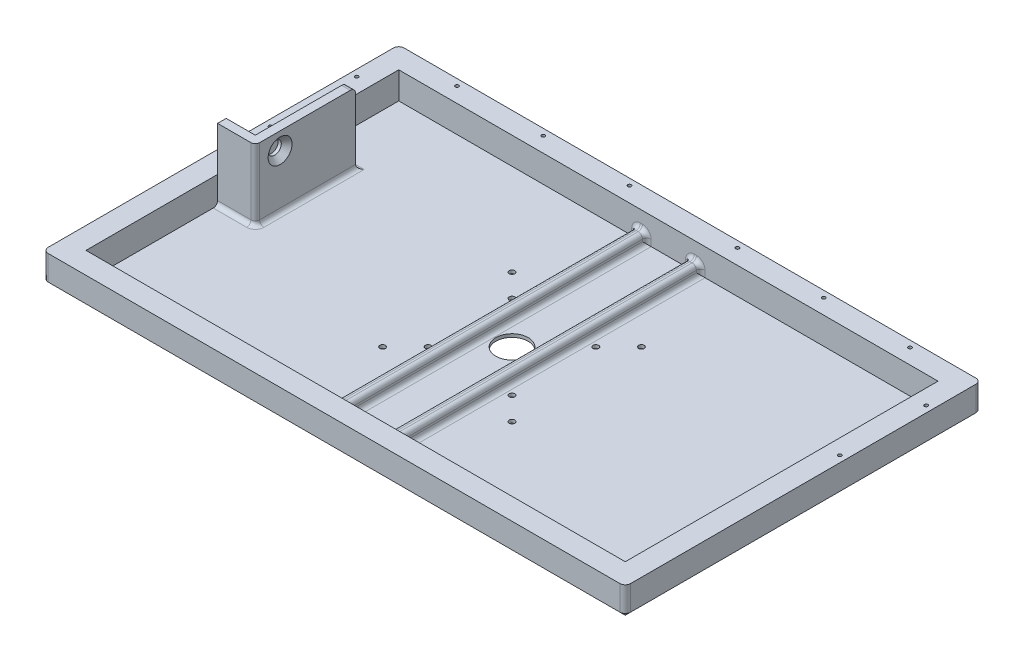
from build123d import *

# Parameters (mm, degrees)
SKETCH1_W           = 540
SKETCH1_H           = 330
BOSS_EXTRUDE1_DEPTH = 3
SKETCH2_W           = 540
SKETCH2_H           = 330
SKETCH2_W_2         = 500
SKETCH2_H_2         = 290
BOSS_EXTRUDE2_DEPTH = 25
FILLET1_R           = 5
SKETCH4_R           = 1.6
CUT_EXTRUDE1_DEPTH  = 28
SKETCH5_R           = 15
CUT_EXTRUDE2_DEPTH  = 3
SKETCH6_W           = 10
SKETCH6_H           = 290
BOSS_EXTRUDE3_DEPTH = 10
FILLET3_R           = 4
CHAMFER1_SIZE       = 5
SKETCH7_R           = 2.6
CUT_EXTRUDE3_DEPTH  = 3
SKETCH9_R           = 2.6
CUT_EXTRUDE4_DEPTH  = 47
SKETCH11_W          = 8
SKETCH11_H          = 140
BOSS_EXTRUDE4_DEPTH = 66
SKETCH12_R          = 6.1
CUT_EXTRUDE5_DEPTH  = 8
SKETCH13_W          = 8
SKETCH13_H          = 69
SKETCH13_W_2        = 20
SKETCH13_H_2        = 40.75
BOSS_EXTRUDE5_DEPTH = 27
SKETCH15_W          = 8
SKETCH15_H          = 47
CUT_EXTRUDE6_DEPTH  = 66
FILLET4_R           = 4
FILLET5_R           = 10
FILLET6_R           = 5
FILLET7_R           = 5
CHAMFER2_SIZE       = 5


with BuildPart() as part:
    # Sketch1 → Boss-Extrude1 (new body)
    with BuildSketch(Plane(origin=(0, 0, 0), x_dir=(1, 0, 0), z_dir=(0, 1, 0))):
        Rectangle(SKETCH1_W, SKETCH1_H)
    extrude(amount=BOSS_EXTRUDE1_DEPTH)

    # Sketch2 → Boss-Extrude2 (add)
    with BuildSketch(Plane(origin=(0, 3, 0), x_dir=(1, 0, 0), z_dir=(0, 1, 0))):
        Rectangle(SKETCH2_W, SKETCH2_H)
        Rectangle(SKETCH2_W_2, SKETCH2_H_2, mode=Mode.SUBTRACT)
    extrude(amount=BOSS_EXTRUDE2_DEPTH)

    # Fillet1
    fillet1_edges = [part.edges().sort_by_distance(p)[0] for p in [
        (270, 14, 165),
        (-270, 14, 165),
        (-270, 14, -165),
        (270, 14, -165),
    ]]
    fillet(fillet1_edges, radius=FILLET1_R)

    # Sketch4 → Cut-Extrude1 (cut)
    with BuildSketch(Plane(origin=(0, 28, 0), x_dir=(1, 0, 0), z_dir=(0, 1, 0))):
        with Locations(Location((-264, 120, 0), (0, 0, 270))):
            Circle(SKETCH4_R)
        with Locations(Location((-264, 40, 0), (0, 0, 270))):
            Circle(SKETCH4_R)
        with Locations(Location((-210, 159, 0), (0, 0, 270))):
            Circle(SKETCH4_R)
        with Locations(Location((-130, 159, 0), (0, 0, 270))):
            Circle(SKETCH4_R)
        with Locations(Location((-50, 159, 0), (0, 0, 270))):
            Circle(SKETCH4_R)
        with Locations(Location((50, 159, 0), (0, 0, 90))):
            Circle(SKETCH4_R)
        with Locations(Location((130, 159, 0), (0, 0, 90))):
            Circle(SKETCH4_R)
        with Locations(Location((210, 159, 0), (0, 0, 90))):
            Circle(SKETCH4_R)
        with Locations(Location((264, 40, 0), (0, 0, 90))):
            Circle(SKETCH4_R)
        with Locations(Location((264, 120, 0), (0, 0, 90))):
            Circle(SKETCH4_R)
    extrude(amount=-CUT_EXTRUDE1_DEPTH, mode=Mode.SUBTRACT)

    # Sketch5 → Cut-Extrude2 (cut)
    with BuildSketch(Plane(origin=(0, 3, 0), x_dir=(1, 0, 0), z_dir=(0, 1, 0))):
        with Locations(Location((0, 0, 0), (0, 0, 270))):
            Circle(SKETCH5_R)
    extrude(amount=-CUT_EXTRUDE2_DEPTH, mode=Mode.SUBTRACT)

    # Sketch6 → Boss-Extrude3 (add)
    with BuildSketch(Plane(origin=(0, 3, 0), x_dir=(1, 0, 0), z_dir=(0, 1, 0))):
        with Locations((25, 0)):
            Rectangle(SKETCH6_W, SKETCH6_H)
        with Locations((-25, 0)):
            Rectangle(SKETCH6_W, SKETCH6_H)
    extrude(amount=BOSS_EXTRUDE3_DEPTH)

    # Fillet3
    fillet3_edges = [part.edges().sort_by_distance(p)[0] for p in [
        (30, 3, 0),
        (30, 8, 145),
        (30, 8, -145),
        (20, 3, 0),
        (20, 8, -145),
        (20, 8, 145),
        (30, 13, 0),
        (25, 13, -145),
        (20, 13, 0),
        (25, 13, 145),
        (-20, 3, 0),
        (-20, 8, 145),
        (-20, 8, -145),
        (-30, 3, 0),
        (-30, 8, -145),
        (-30, 8, 145),
        (-20, 13, 0),
        (-25, 13, -145),
        (-30, 13, 0),
        (-25, 13, 145),
    ]]
    fillet(fillet3_edges, radius=FILLET3_R)

    # Chamfer1
    # the kernel refuses this chamfer: 5 mm, written as the material it takes off along each edge
    with BuildSketch(Plane(origin=(-270, 0, -160), x_dir=(0, 1, 0), z_dir=(0, 0, 1)), Plane(origin=(270, 0, 160), x_dir=(0, 1, 0), z_dir=(0, 0, -1))) as chamfer1_piece_1:
        Polygon((CHAMFER1_SIZE, 0), (0, -CHAMFER1_SIZE), (0, 0), align=None)
    extrude(amount=320, mode=Mode.SUBTRACT)
    with BuildSketch(Plane(origin=(-265, 0, 165), x_dir=(0, 1, 0), z_dir=(1, 0, 0)), Plane(origin=(265, 0, -165), x_dir=(0, 1, 0), z_dir=(-1, 0, 0))) as chamfer1_piece_2:
        Polygon((CHAMFER1_SIZE, 0), (0, -CHAMFER1_SIZE), (0, 0), align=None)
    extrude(amount=530, mode=Mode.SUBTRACT)
    with BuildSketch(Plane(origin=(265, 0, -160), x_dir=(0, 0, -1), z_dir=(-1, 0, 0))) as chamfer1_piece_3:
        Polygon((5, -CHAMFER1_SIZE), (5 - CHAMFER1_SIZE, 0), (5, 0), align=None)
    revolve(axis=Axis((265, 0, -160), (0, -1, 0)), revolution_arc=90, mode=Mode.SUBTRACT)
    with BuildSketch(Plane(origin=(265, 0, 160), x_dir=(0, 0, 1), z_dir=(-1, 0, 0))) as chamfer1_piece_4:
        Polygon((5, CHAMFER1_SIZE), (5 - CHAMFER1_SIZE, 0), (5, 0), align=None)
    revolve(axis=Axis((265, 0, 160), (0, 1, 0)), revolution_arc=90, mode=Mode.SUBTRACT)
    with BuildSketch(Plane(origin=(-265, 0, 160), x_dir=(0, 0, 1), z_dir=(1, 0, 0))) as chamfer1_piece_5:
        Polygon((5, -CHAMFER1_SIZE), (5 - CHAMFER1_SIZE, 0), (5, 0), align=None)
    revolve(axis=Axis((-265, 0, 160), (0, -1, 0)), revolution_arc=90, mode=Mode.SUBTRACT)
    with BuildSketch(Plane(origin=(-265, 0, -160), x_dir=(0, 0, -1), z_dir=(1, 0, 0))) as chamfer1_piece_6:
        Polygon((5, CHAMFER1_SIZE), (5 - CHAMFER1_SIZE, 0), (5, 0), align=None)
    revolve(axis=Axis((-265, 0, -160), (0, 1, 0)), revolution_arc=90, mode=Mode.SUBTRACT)

    # Sketch7 → Cut-Extrude3 (cut)
    with BuildSketch(Plane.XZ):
        with Locations(Location((-60, 60, 0), (0, 0, 270))):
            Circle(SKETCH7_R)
        with Locations(Location((60, 60, 0), (0, 0, 270))):
            Circle(SKETCH7_R)
        with Locations(Location((60, -60, 0), (0, 0, 270))):
            Circle(SKETCH7_R)
        with Locations(Location((-60, -60, 0), (0, 0, 270))):
            Circle(SKETCH7_R)
    extrude(amount=-CUT_EXTRUDE3_DEPTH, mode=Mode.SUBTRACT)

    # Sketch9 → Cut-Extrude4 (cut)
    with BuildSketch(Plane.XZ):
        with Locations(Location((-38.890872965, 38.890872965, 0), (0, 0, 270))):
            Circle(SKETCH9_R)
        with Locations(Location((38.890872965, 38.890872965, 0), (0, 0, 270))):
            Circle(SKETCH9_R)
        with Locations(Location((38.890872965, -38.890872965, 0), (0, 0, 270))):
            Circle(SKETCH9_R)
        with Locations(Location((-38.890872965, -38.890872965, 0), (0, 0, 270))):
            Circle(SKETCH9_R)
    extrude(amount=-CUT_EXTRUDE4_DEPTH, mode=Mode.SUBTRACT)

    # Sketch11 → Boss-Extrude4 (add)
    with BuildSketch(Plane(origin=(0, 3, 0), x_dir=(1, 0, 0), z_dir=(0, 1, 0))):
        with Locations((-219, 0)):
            Rectangle(SKETCH11_W, SKETCH11_H)
    extrude(amount=BOSS_EXTRUDE4_DEPTH)

    # Sketch12 → Cut-Extrude5 (cut)
    with BuildSketch(Plane.ZY.offset(223)):
        with Locations((0, 53)):
            Circle(SKETCH12_R)
    extrude(amount=-CUT_EXTRUDE5_DEPTH, mode=Mode.SUBTRACT)

    # Sketch13 → Boss-Extrude5 (add)
    with BuildSketch(Plane.ZY.offset(223)):
        with Locations((19, 34.5)):
            Rectangle(SKETCH13_W, SKETCH13_H)
        with Locations((-60, 20.375)):
            Rectangle(SKETCH13_W_2, SKETCH13_H_2)
    extrude(amount=BOSS_EXTRUDE5_DEPTH)

    # Sketch15 → Cut-Extrude6 (cut)
    with BuildSketch(Plane(origin=(0, 69, 0), x_dir=(1, 0, 0), z_dir=(0, 1, 0))):
        with Locations((-219, -46.5)):
            Rectangle(SKETCH15_W, SKETCH15_H)
    extrude(amount=-CUT_EXTRUDE6_DEPTH, mode=Mode.SUBTRACT)

    # Fillet4
    fillet4_edges = [part.edges().sort_by_distance(p)[0] for p in [
        (-232.5, 3, -70),
        (-232.5, 3, 23),
        (-215, 3, -23.5),
        (-215, 36, 23),
    ]]
    fillet(fillet4_edges, radius=FILLET4_R)

    # Fillet5
    fillet5_edges = [part.edges().sort_by_distance(p)[0] for p in [
        (-223, 40.75, -60),
    ]]
    fillet(fillet5_edges, radius=FILLET5_R)

    # Fillet6
    fillet6_edges = [part.edges().sort_by_distance(p)[0] for p in [
        (-250, 40.75, -60),
    ]]
    fillet(fillet6_edges, radius=FILLET6_R)

    # Fillet7
    fillet7_edges = [part.edges().sort_by_distance(p)[0] for p in [
        (-219, 69, -70),
    ]]
    fillet(fillet7_edges, radius=FILLET7_R)

    # Chamfer2
    chamfer2_edges = [part.edges().sort_by_distance(p)[0] for p in [
        (-215, 53, -6.1),
    ]]
    chamfer(chamfer2_edges, length=CHAMFER2_SIZE)


solid = part.part
